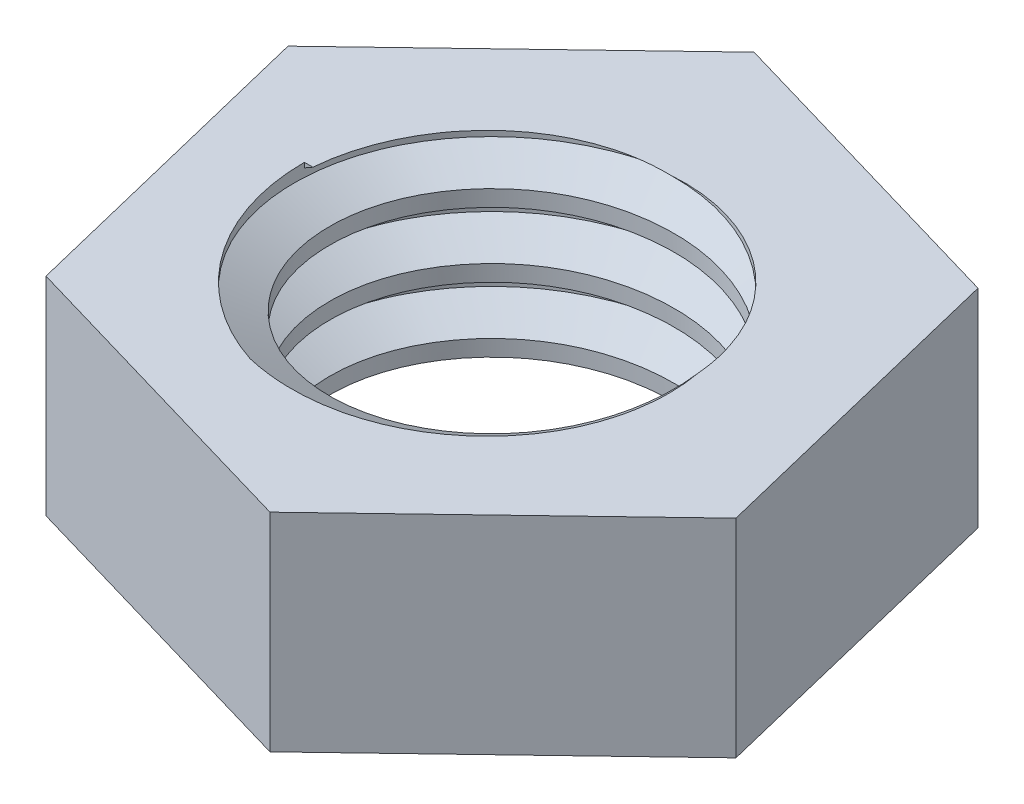
from build123d import *

# Parameters (mm, degrees)
BOSS_EXTRUDE1_DEPTH = 4
SKETCH2_R           = 4
CUT_EXTRUDE1_DEPTH  = 10.551330914
THREAD2_PITCH       = 1.25
SKETCH7_R           = 21.028311622
CUT_EXTRUDE2_DEPTH  = 11.01156281
SKETCH8_R           = 21.037382845
CUT_EXTRUDE3_DEPTH  = 10.551331084


with BuildPart() as part:
    # Sketch1 → Boss-Extrude1 (new body)
    with BuildSketch(Plane(origin=(0, 0, 0), x_dir=(1, 0, 0), z_dir=(0, 1, 0))):
        Polygon((4.59026656, 4.388939079), (-1.505799458, 6.169756991), (-6.096066018, 1.780817911), (-4.59026656, -4.388939079), (1.505799458, -6.169756991), (6.096066018, -1.780817911), align=None)
    extrude(amount=BOSS_EXTRUDE1_DEPTH)

    # Sketch2 → Cut-Extrude1 (cut, through all)
    with BuildSketch(Plane(origin=(0, 4, 0), x_dir=(1, 0, 0), z_dir=(0, 1, 0))):
        with Locations(Location((0, 0, 0), (0, 0, 270))):
            Circle(SKETCH2_R)
    extrude(amount=-CUT_EXTRUDE1_DEPTH, mode=Mode.SUBTRACT)

    # Thread2: the profile of Thread Profile2 profile screwed along a right-hand helix of 6.4 turns, 8 arcs to a turn; built about Z, then put on its axis
    thread2_z = Axis((0, 0, 0), (0, 0, 1))
    thread2_corners = [(4.0006, 0, -0.00034641), (4.0006, 0, 1.094096407), (3.323417656, 0, 0.703124998), (3.323417656, 0, 0.390624998)]
    with BuildLine(mode=Mode.PRIVATE) as thread2_profile:
        Line(thread2_corners[0], thread2_corners[1])
        Line(thread2_corners[1], thread2_corners[2])
        Line(thread2_corners[2], thread2_corners[3])
        Line(thread2_corners[3], thread2_corners[0])
    thread2_cap = Face(thread2_profile.wire())
    thread2_turn_angles = [0, 22.5, 45, 67.5, 90, 112.5, 135, 157.5, 180, 202.5, 225, 247.5, 270, 292.5, 315, 337.5, 360]
    thread2_turn_weights = [1, 0.9238795325112867, 1, 0.9238795325112867, 1, 0.9238795325112867, 1, 0.9238795325112867, 1, 0.9238795325112867, 1, 0.9238795325112867, 1, 0.9238795325112867, 1, 0.9238795325112867, 1]
    thread2_turn_rails = [Edge.make_bspline([Vector(p[0], p[1], 0).rotate(thread2_z, thread2_turn_angles[k]) / thread2_turn_weights[k] + Vector(0, 0, p[2] + THREAD2_PITCH * thread2_turn_angles[k] / 360) for k in range(17)], [0, 0, 0, 1, 1, 2, 2, 3, 3, 4, 4, 5, 5, 6, 6, 7, 7, 8, 8, 8], 2, thread2_turn_weights) for p in thread2_corners]
    thread2_turn_sides = [Face.make_surface_from_curves(thread2_turn_rails[p[0]], thread2_turn_rails[p[1]]) for p in [(0, 1), (1, 2), (2, 3), (3, 0)]]
    thread2_last_angles = [2160, 2182.5, 2205, 2227.5, 2250, 2272.5, 2295, 2299.5, 2304]
    thread2_last_weights = [1, 0.9238795325112867, 1, 0.9238795325112867, 1, 0.9238795325112867, 1, 0.996917333733128, 1]
    thread2_last_rails = [Edge.make_bspline([Vector(p[0], p[1], 0).rotate(thread2_z, thread2_last_angles[k]) / thread2_last_weights[k] + Vector(0, 0, p[2] + THREAD2_PITCH * thread2_last_angles[k] / 360) for k in range(9)], [0, 0, 0, 1, 1, 2, 2, 3, 3, 4, 4, 4], 2, thread2_last_weights) for p in thread2_corners]
    thread2_last_sides = [Face.make_surface_from_curves(thread2_last_rails[p[0]], thread2_last_rails[p[1]]) for p in [(0, 1), (1, 2), (2, 3), (3, 0)]]
    thread2 = Plane(origin=(0, 5, 0), x_dir=(-1, 0, 0), z_dir=(0, -1, 0)) * Solid(Shell([*[p.moved(Location((0, 0, THREAD2_PITCH * i))) for i in range(6) for p in thread2_turn_sides], *thread2_last_sides, thread2_cap, thread2_cap.rotate(thread2_z, 2304).moved(Location((0, 0, THREAD2_PITCH * 2304 / 360)))]))
    add(thread2)

    # Sketch7 → Cut-Extrude2 (cut, through all)
    with BuildSketch(Plane.XZ):
        with Locations((-8.727451128, 7.028819701)):
            Circle(SKETCH7_R)
    extrude(amount=CUT_EXTRUDE2_DEPTH, mode=Mode.SUBTRACT)

    # Sketch8 → Cut-Extrude3 (cut, through all)
    with BuildSketch(Plane(origin=(0, 4, 0), x_dir=(1, 0, 0), z_dir=(0, 1, 0))):
        with Locations((-10.113690569, 5.935447747)):
            Circle(SKETCH8_R)
    extrude(amount=CUT_EXTRUDE3_DEPTH, mode=Mode.SUBTRACT)


solid = part.part
